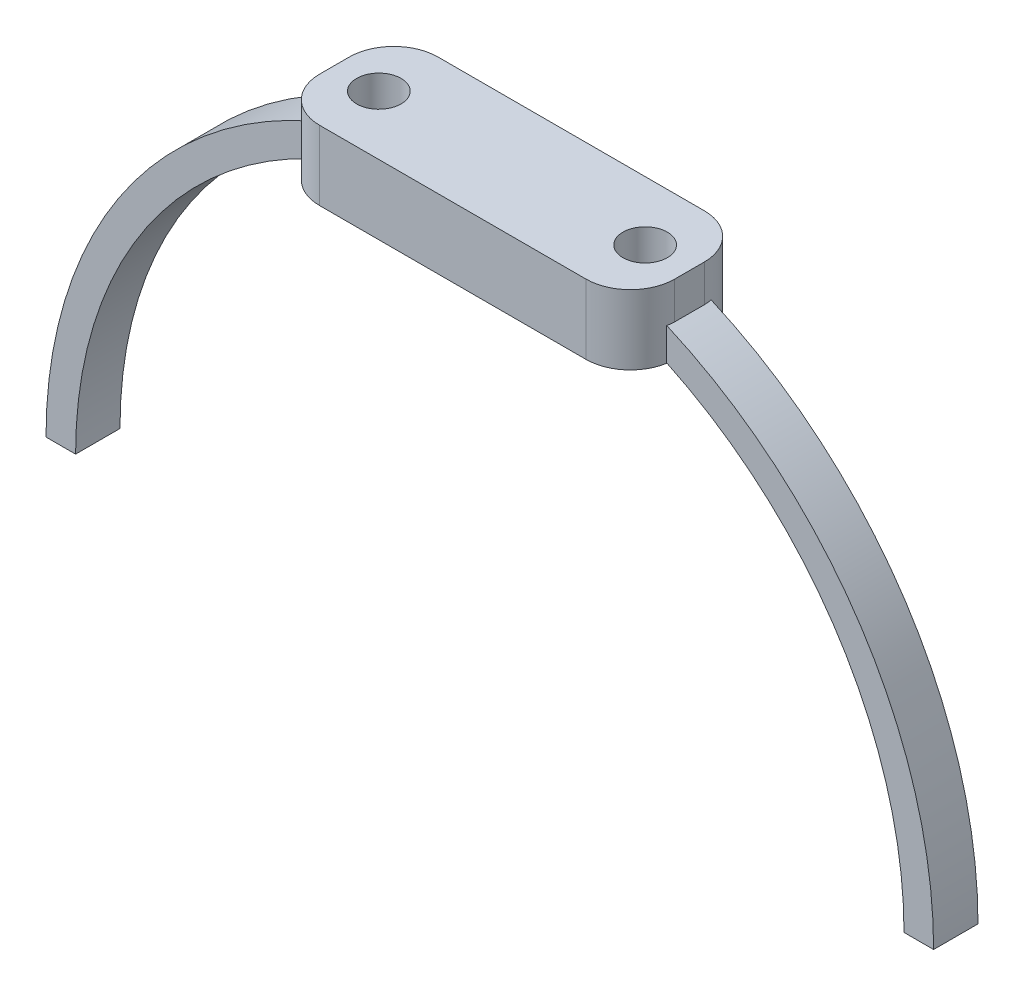
from build123d import *

# Parameters (mm, degrees)
SKETCH_2_W           = 24
SKETCH_2_H           = 8
EXTRUDE_1_DEPTH      = 1
EXTRUDE_3_DEPTH      = 1.5
EXTRUDE_3_DEPTH_BACK = 1.5
EXTRUDE_5_REACH      = 45.174
SKETCH_7_W           = 24
SKETCH_7_H           = 4.701778719
SKETCH_3_R           = 1.5
CUT_EXTRUDE_1_DEPTH  = 43.614551505
FILLET_1_R           = 3


with BuildPart() as part:
    # 草图2 → 凸台-拉伸1 (new body)
    with BuildSketch(Plane(origin=(0, 0, 0), x_dir=(1, 0, 0), z_dir=(0, 1, 0))):
        Rectangle(SKETCH_2_W, SKETCH_2_H)
    extrude(amount=-EXTRUDE_1_DEPTH)

    # 凸台-拉伸5: up to this face of the body (flat: up to its plane)
    extrude_5_end = Plane(part.part.faces().sort_by_distance((0, -0.5, -4))[0])
    # 草图7 → 凸台-拉伸5 (add, up to the picked face)
    with BuildSketch(Plane.XY.offset(4), mode=Mode.PRIVATE) as extrude_5_sk1:
        with Locations((0, -2.350889359)):
            Rectangle(SKETCH_7_W, SKETCH_7_H)
    extrude_5_tool1 = split(extrude(extrude_5_sk1.sketch, amount=-EXTRUDE_5_REACH, mode=Mode.PRIVATE), bisect_by=extrude_5_end, keep=Keep.BOTH, mode=Mode.PRIVATE)


with BuildPart() as body_2:
    # 草图5 → 凸台-拉伸3 (new, two sides: drawn at the far end of the back side and taken through both)
    with BuildSketch(Plane.XY.offset(-EXTRUDE_3_DEPTH_BACK)):
        with BuildLine():
            ThreePointArc((30, -30), (21.213203436, -8.786796564), (0, 0))
            Line((0, 0), (0, -2))
            ThreePointArc((0, -2), (19.798989873, -10.201010127), (28, -30))
            Line((28, -30), (30, -30))
        make_face()
        with BuildLine():
            Line((0, -2), (0, 0))
            ThreePointArc((0, 0), (-21.213203436, -8.786796564), (-30, -30))
            Line((-30, -30), (-28, -30))
            ThreePointArc((-28, -30), (-19.798989873, -10.201010127), (0, -2))
        make_face()
    extrude(amount=EXTRUDE_3_DEPTH + EXTRUDE_3_DEPTH_BACK)


with BuildPart() as part_1:
    add(part.part)

    add(body_2.part)  # 凸台-拉伸5 merges body 2
    add(extrude_5_tool1.solids().sort_by(Axis((0, -2.350889, 4), (0, 0, -1)))[0])

    # 草图3 → 切除-拉伸1 (cut, through all)
    with BuildSketch(Plane(origin=(0, 0, 0), x_dir=(1, 0, 0), z_dir=(0, 1, 0))):
        with Locations(Location((-9, 0, 0), (0, 0, 270))):
            Circle(SKETCH_3_R)
        with Locations(Location((9, 0, 0), (0, 0, 270))):
            Circle(SKETCH_3_R)
    extrude(amount=-CUT_EXTRUDE_1_DEPTH, mode=Mode.SUBTRACT)

    # 圆角1
    # the kernel refuses this fillet: 3 mm, written as the material it takes off along each edge
    with BuildSketch(Plane(origin=(-12, -12.201778719, 4), x_dir=(0, 0, -1), z_dir=(0, 1, 0))) as fillet_1_piece_1_section:
        with BuildLine():
            CenterArc((FILLET_1_R, -FILLET_1_R), FILLET_1_R, 90, 90)
            Line((0, -FILLET_1_R), (0, 0))
            Line((0, 0), (FILLET_1_R, 0))
        make_face()
    fillet_1_piece_1 = extrude(amount=19.701778719, mode=Mode.PRIVATE)
    fillet_1_piece_1 = split(fillet_1_piece_1, bisect_by=Plane(origin=(-10.876445005, -4.454369233, 1.5), z_dir=(0, 0, 1)), keep=Keep.TOP, mode=Mode.PRIVATE)
    add(fillet_1_piece_1, mode=Mode.SUBTRACT)
    with BuildSketch(Plane(origin=(-12, -12.201778719, 4), x_dir=(0, 0, -1), z_dir=(0, 1, 0))) as fillet_1_piece_2_section:
        with BuildLine():
            CenterArc((FILLET_1_R, -FILLET_1_R), FILLET_1_R, 90, 90)
            Line((0, -FILLET_1_R), (0, 0))
            Line((0, 0), (FILLET_1_R, 0))
        make_face()
    fillet_1_piece_2 = extrude(amount=19.701778719, mode=Mode.PRIVATE)
    fillet_1_piece_2 = fillet_1_piece_2 - Plane(origin=(0, -30, 1.375084053), x_dir=(1, 0, 0), z_dir=(0, 0, -1)) * Cylinder(30, 52, mode=Mode.PRIVATE)
    add(fillet_1_piece_2, mode=Mode.SUBTRACT)
    with BuildSketch(Plane(origin=(-12, -12.201778719, -4), x_dir=(1, 0, 0), z_dir=(0, 1, 0))) as fillet_1_piece_3_section:
        with BuildLine():
            CenterArc((FILLET_1_R, -FILLET_1_R), FILLET_1_R, 90, 90)
            Line((0, -FILLET_1_R), (0, 0))
            Line((0, 0), (FILLET_1_R, 0))
        make_face()
    fillet_1_piece_3 = extrude(amount=19.701778719, mode=Mode.PRIVATE)
    fillet_1_piece_3 = split(fillet_1_piece_3, bisect_by=Plane(origin=(-10.876427582, -4.45436464, -1.5), z_dir=(0, 0, -1)), keep=Keep.TOP, mode=Mode.PRIVATE)
    add(fillet_1_piece_3, mode=Mode.SUBTRACT)
    with BuildSketch(Plane(origin=(-12, -12.201778719, -4), x_dir=(1, 0, 0), z_dir=(0, 1, 0))) as fillet_1_piece_4_section:
        with BuildLine():
            CenterArc((FILLET_1_R, -FILLET_1_R), FILLET_1_R, 90, 90)
            Line((0, -FILLET_1_R), (0, 0))
            Line((0, 0), (FILLET_1_R, 0))
        make_face()
    fillet_1_piece_4 = extrude(amount=19.701778719, mode=Mode.PRIVATE)
    fillet_1_piece_4 = fillet_1_piece_4 - Plane(origin=(0, -30, -1.375084091), x_dir=(1, 0, 0), z_dir=(0, 0, -1)) * Cylinder(30, 52, mode=Mode.PRIVATE)
    add(fillet_1_piece_4, mode=Mode.SUBTRACT)
    with BuildSketch(Plane(origin=(12, 7.5, 4), x_dir=(0, 0, -1), z_dir=(0, -1, 0))) as fillet_1_piece_5_section:
        with BuildLine():
            CenterArc((FILLET_1_R, -FILLET_1_R), FILLET_1_R, 90, 90)
            Line((0, -FILLET_1_R), (0, 0))
            Line((0, 0), (FILLET_1_R, 0))
        make_face()
    fillet_1_piece_5 = extrude(amount=19.701778719, mode=Mode.PRIVATE)
    fillet_1_piece_5 = fillet_1_piece_5 - Plane(origin=(0, -30, 1.375084091), x_dir=(1, 0, 0), z_dir=(0, 0, -1)) * Cylinder(30, 52, mode=Mode.PRIVATE)
    add(fillet_1_piece_5, mode=Mode.SUBTRACT)
    with BuildSketch(Plane(origin=(12, 7.5, 4), x_dir=(0, 0, -1), z_dir=(0, -1, 0))) as fillet_1_piece_6_section:
        with BuildLine():
            CenterArc((FILLET_1_R, -FILLET_1_R), FILLET_1_R, 90, 90)
            Line((0, -FILLET_1_R), (0, 0))
            Line((0, 0), (FILLET_1_R, 0))
        make_face()
    fillet_1_piece_6 = extrude(amount=19.701778719, mode=Mode.PRIVATE)
    fillet_1_piece_6 = split(fillet_1_piece_6, bisect_by=Plane(origin=(11.332354587, -3.316124118, 1.5), z_dir=(0, 0, 1)), keep=Keep.TOP, mode=Mode.PRIVATE)
    add(fillet_1_piece_6, mode=Mode.SUBTRACT)
    with BuildSketch(Plane(origin=(12, 7.5, -4), x_dir=(-1, 0, 0), z_dir=(0, -1, 0))) as fillet_1_piece_7_section:
        with BuildLine():
            CenterArc((FILLET_1_R, -FILLET_1_R), FILLET_1_R, 90, 90)
            Line((0, -FILLET_1_R), (0, 0))
            Line((0, 0), (FILLET_1_R, 0))
        make_face()
    fillet_1_piece_7 = extrude(amount=19.701778719, mode=Mode.PRIVATE)
    fillet_1_piece_7 = split(fillet_1_piece_7, bisect_by=Plane(origin=(11.383708583, -1.124807359, -1.5), z_dir=(0, 0, -1)), keep=Keep.TOP, mode=Mode.PRIVATE)
    add(fillet_1_piece_7, mode=Mode.SUBTRACT)
    with BuildSketch(Plane(origin=(12, 7.5, -4), x_dir=(-1, 0, 0), z_dir=(0, -1, 0))) as fillet_1_piece_8_section:
        with BuildLine():
            CenterArc((FILLET_1_R, -FILLET_1_R), FILLET_1_R, 90, 90)
            Line((0, -FILLET_1_R), (0, 0))
            Line((0, 0), (FILLET_1_R, 0))
        make_face()
    fillet_1_piece_8 = extrude(amount=19.701778719, mode=Mode.PRIVATE)
    fillet_1_piece_8 = fillet_1_piece_8 - Plane(origin=(0, -30, -1.375084091), x_dir=(1, 0, 0), z_dir=(0, 0, -1)) * Cylinder(30, 52, mode=Mode.PRIVATE)
    add(fillet_1_piece_8, mode=Mode.SUBTRACT)


solid = part_1.part
